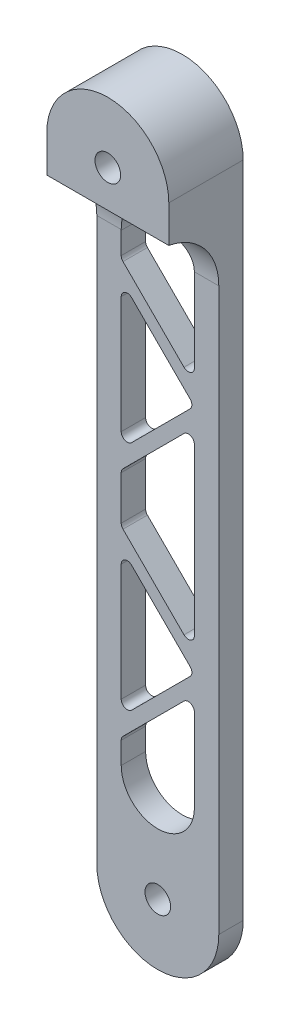
from build123d import *

# Parameters (mm, degrees)
CROQUIS1_R              = 2.1
SALIENTE_EXTRUIR1_DEPTH = 4
CROQUIS1_6_R            = 2.1
SALIENTE_EXTRUIR3_DEPTH = 12.2
REDONDEO1_R             = 10
REDONDEO2_R             = 1


with BuildPart() as part:
    # Croquis1 → Saliente-Extruir1 (new body)
    with BuildSketch(Plane.XY):
        with BuildLine():
            ThreePointArc((10, 54), (0, 64), (-10, 54))
            Line((-10, 54), (-10, -54))
            ThreePointArc((-10, -54), (0, -64), (10, -54))
            Line((10, -54), (10, 54))
        make_face()
        with Locations((0, 54)):
            Circle(CROQUIS1_R, mode=Mode.SUBTRACT)
        with BuildLine():
            Line((6, 38), (6, 22))
            Line((6, 22), (-6, 34))
            Line((-6, 34), (-6, 38))
            ThreePointArc((-6, 38), (0, 44), (6, 38))
        make_face(mode=Mode.SUBTRACT)
        Polygon((6, 16), (6, -16), (-6, -4), (-6, 4), align=None, mode=Mode.SUBTRACT)
        with BuildLine():
            Line((6, -22), (6, -38))
            ThreePointArc((6, -38), (0, -44), (-6, -38))
            Line((-6, -38), (-6, -34))
            Line((-6, -34), (6, -22))
        make_face(mode=Mode.SUBTRACT)
        Polygon((-6, -31), (-6, -7), (6, -19), align=None, mode=Mode.SUBTRACT)
        Polygon((-6, 7), (-6, 31), (6, 19), align=None, mode=Mode.SUBTRACT)
        with Locations((0, -54)):
            Circle(CROQUIS1_R, mode=Mode.SUBTRACT)
    extrude(amount=SALIENTE_EXTRUIR1_DEPTH)

    # Croquis1<6> → Saliente-Extruir3 (add)
    with BuildSketch(Plane.XY):
        with BuildLine():
            Line((10, 47.95), (10, 54))
            ThreePointArc((10, 54), (0, 64), (-10, 54))
            Line((-10, 54), (-10, 47.95))
            Line((-10, 47.95), (10, 47.95))
        make_face()
        with Locations((0, 54)):
            Circle(CROQUIS1_6_R, mode=Mode.SUBTRACT)
    extrude(amount=SALIENTE_EXTRUIR3_DEPTH)

    # Redondeo1
    # the kernel refuses this fillet: 10 mm, written as the material it adds along each edge
    with BuildSketch(Plane(origin=(10, 47.95, 4), x_dir=(0, 0, 1), z_dir=(-1, 0, 0))) as redondeo1_piece_1_section:
        with BuildLine():
            CenterArc((10, -9.836666102), REDONDEO1_R, 100.369759805, 79.630240195)
            Line((0, -9.836666102), (-0.2, -9.836666102))
            Line((-0.2, -9.836666102), (-0.2, 0))
            Line((-0.2, 0), (0, 0.2))
            ThreePointArc((0, 0.2), (4.1, 0.2), (8.164, 0.196733322))
            Line((8.164, 0.196733322), (8.2, 0))
        make_face()
    redondeo1_piece_1 = extrude(amount=20, mode=Mode.PRIVATE)
    redondeo1_piece_1 = redondeo1_piece_1 - Plane(origin=(0, 38, 6.176378177), x_dir=(-1, 0, 0), z_dir=(0, 0, -1)) * Cylinder(6, 80, mode=Mode.PRIVATE)
    add(redondeo1_piece_1)

    # Redondeo2
    redondeo2_edges = [part.edges().sort_by_distance(p)[0] for p in [
        (6, 22, 2),
        (-6, 34, 2),
        (6, -22, 2),
        (-6, -34, 2),
        (-6, -31, 2),
        (6, -19, 2),
        (-6, -7, 2),
        (-6, -4, 2),
        (6, -16, 2),
        (6, 16, 2),
        (-6, 4, 2),
        (-6, 7, 2),
        (6, 19, 2),
        (-6, 31, 2),
    ]]
    fillet(redondeo2_edges, radius=REDONDEO2_R)


solid = part.part
